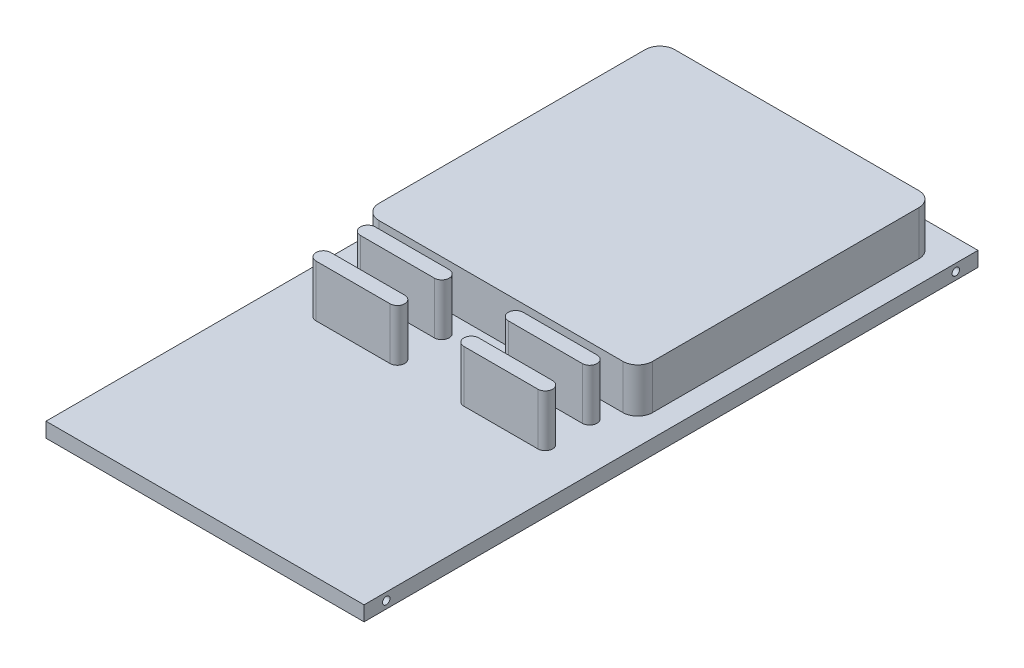
from build123d import *

# Parameters (mm, degrees)
SKETCH1_W           = 54.61
SKETCH1_H           = 105.41
BOSS_EXTRUDE1_DEPTH = 2.54
BOSS_EXTRUDE2_DEPTH = 8.89
SKETCH4_R           = 0.635
CUT_EXTRUDE1_DEPTH  = 10.16
SKETCH5_W           = 46.99
SKETCH5_H           = 50.8
BOSS_EXTRUDE3_DEPTH = 7.62
FILLET1_R           = 2.54


with BuildPart() as part:
    # Sketch1 → Boss-Extrude1 (new body)
    with BuildSketch(Plane(origin=(0, 0, 0), x_dir=(1, 0, 0), z_dir=(0, 1, 0))):
        with Locations((27.305, 52.705)):
            Rectangle(SKETCH1_W, SKETCH1_H)
    extrude(amount=BOSS_EXTRUDE1_DEPTH)

    # Sketch2 → Boss-Extrude2 (add)
    with BuildSketch(Plane(origin=(0, 2.54, 0), x_dir=(1, 0, 0), z_dir=(0, 1, 0))):
        with BuildLine():
            Line((8.255, 40.64), (20.955, 40.64))
            ThreePointArc((20.955, 40.64), (22.225, 39.37), (20.955, 38.1))
            Line((20.955, 38.1), (8.255, 38.1))
            ThreePointArc((8.255, 38.1), (6.985, 39.37), (8.255, 40.64))
        make_face()
        with BuildLine():
            Line((46.355, 40.64), (33.655, 40.64))
            ThreePointArc((33.655, 40.64), (32.385, 39.37), (33.655, 38.1))
            Line((33.655, 38.1), (46.355, 38.1))
            ThreePointArc((46.355, 38.1), (47.625, 39.37), (46.355, 40.64))
        make_face()
        with BuildLine():
            Line((8.255, 48.26), (20.955, 48.26))
            ThreePointArc((20.955, 48.26), (22.225, 46.99), (20.955, 45.72))
            Line((20.955, 45.72), (8.255, 45.72))
            ThreePointArc((8.255, 45.72), (6.985, 46.99), (8.255, 48.26))
        make_face()
        with BuildLine():
            Line((46.355, 48.26), (33.655, 48.26))
            ThreePointArc((33.655, 48.26), (32.385, 46.99), (33.655, 45.72))
            Line((33.655, 45.72), (46.355, 45.72))
            ThreePointArc((46.355, 45.72), (47.625, 46.99), (46.355, 48.26))
        make_face()
    extrude(amount=BOSS_EXTRUDE2_DEPTH)

    # Sketch4 → Cut-Extrude1 (cut)
    with BuildSketch(Plane.ZY):
        with Locations((-101.6, 1.27)):
            Circle(SKETCH4_R)
        with Locations((-3.81, 1.27)):
            Circle(SKETCH4_R)
    cut_extrude1 = extrude(amount=-CUT_EXTRUDE1_DEPTH, mode=Mode.SUBTRACT)

    # Mirror1: Cut-Extrude1 across plane
    add(cut_extrude1.mirror(Plane.ZY.offset(-27.305)), mode=Mode.SUBTRACT)

    # Sketch5 → Boss-Extrude3 (add)
    with BuildSketch(Plane(origin=(0, 2.54, 0), x_dir=(1, 0, 0), z_dir=(0, 1, 0))):
        with Locations((27.305, 76.2)):
            Rectangle(SKETCH5_W, SKETCH5_H)
    extrude(amount=BOSS_EXTRUDE3_DEPTH)

    # Fillet1
    fillet1_edges = [part.edges().sort_by_distance(p)[0] for p in [
        (50.8, 6.35, -50.8),
        (50.8, 6.35, -101.6),
        (3.81, 6.35, -101.6),
        (3.81, 6.35, -50.8),
    ]]
    fillet(fillet1_edges, radius=FILLET1_R)


solid = part.part
